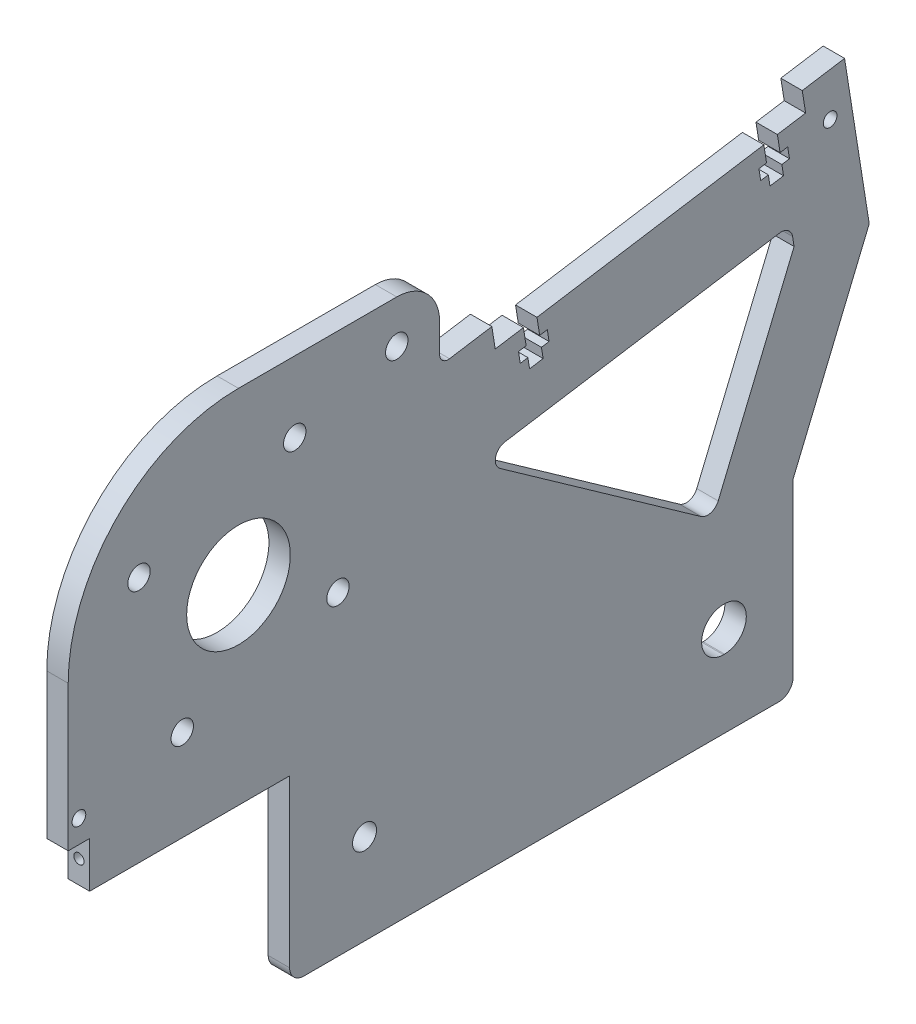
from build123d import *

# Parameters (mm, degrees)
SKETCH1_R           = 2.4892
SKETCH1_R_2         = 2.667
SKETCH1_R_3         = 1.524
SKETCH1_R_4         = 11.522750336
BOSS_EXTRUDE1_DEPTH = 4.7625
SKETCH2_R           = 1.1303
CUT_EXTRUDE1_DEPTH  = 6.35


with BuildPart() as part:
    # Sketch1 → Boss-Extrude1 (new body)
    with BuildSketch(Plane(origin=(0, 0, 0), x_dir=(0, 0, -1), z_dir=(1, 0, 0))):
        with BuildLine():
            Line((-28.170295117, 0), (77.382795117, 0))
            ThreePointArc((77.382795117, 0), (79.627859148, 0.92993597), (80.557795117, 3.175))
            Line((80.557795117, 3.175), (80.557795117, 41.307035595))
            Line((80.557795117, 41.307035595), (97.47645297, 81.978005717))
            Line((97.47645297, 81.978005717), (92.000706017, 116.550511334))
            Line((92.000706017, 116.550511334), (82.592974573, 115.060473054))
            Line((82.592974573, 115.060473054), (83.337993713, 110.356607332))
            Line((83.337993713, 110.356607332), (77.06617275, 109.363248479))
            Line((77.06617275, 109.363248479), (77.667154856, 105.568796797))
            Line((77.667154856, 105.568796797), (79.360546516, 105.837003687))
            Line((79.360546516, 105.837003687), (79.752923263, 103.359634407))
            Line((79.752923263, 103.359634407), (78.059531603, 103.091427516))
            Line((78.059531603, 103.091427516), (78.432041173, 100.739494655))
            Line((78.432041173, 100.739494655), (75.421567111, 100.262682406))
            Line((75.421567111, 100.262682406), (75.049057541, 102.614615267))
            Line((75.049057541, 102.614615267), (73.355665881, 102.346408377))
            Line((73.355665881, 102.346408377), (72.963289134, 104.823777657))
            Line((72.963289134, 104.823777657), (74.656680794, 105.091984547))
            Line((74.656680794, 105.091984547), (74.055698688, 108.88643623))
            Line((74.055698688, 108.88643623), (23.630258147, 100.899831052))
            Line((23.630258147, 100.899831052), (24.231240253, 97.105379369))
            Line((24.231240253, 97.105379369), (25.924631913, 97.373586259))
            Line((25.924631913, 97.373586259), (26.31700866, 94.896216979))
            Line((26.31700866, 94.896216979), (24.623617, 94.628010089))
            Line((24.623617, 94.628010089), (24.99612657, 92.276077228))
            Line((24.99612657, 92.276077228), (21.985652508, 91.799264978))
            Line((21.985652508, 91.799264978), (21.613142938, 94.151197839))
            Line((21.613142938, 94.151197839), (19.919751278, 93.882990949))
            Line((19.919751278, 93.882990949), (19.527374531, 96.360360229))
            Line((19.527374531, 96.360360229), (21.220766191, 96.62856712))
            Line((21.220766191, 96.62856712), (20.619784085, 100.423018802))
            Line((20.619784085, 100.423018802), (14.347963122, 99.429659949))
            Line((14.347963122, 99.429659949), (13.602943983, 104.133525671))
            Line((13.602943983, 104.133525671), (4.195212538, 102.643487392))
            ThreePointArc((4.195212538, 102.643487392), (2.66000635, 103.076460316), (1.992204883, 104.52503368))
            Line((1.992204883, 104.52503368), (1.992204883, 110.875))
            ThreePointArc((1.992204883, 110.875), (-0.797603027, 117.610192091), (-7.532795117, 120.4))
            Line((-7.532795117, 120.4), (-42.707795117, 120.4))
            ThreePointArc((-42.707795117, 120.4), (-69.471786785, 109.313991668), (-80.557795117, 82.55))
            Line((-80.557795117, 82.55), (-80.557795117, 50.292))
            Line((-80.557795117, 50.292), (-75.795295117, 50.292))
            Line((-75.795295117, 50.292), (-75.795295117, 40.132))
            Line((-75.795295117, 40.132), (-31.345295117, 40.132))
            Line((-31.345295117, 40.132), (-31.345295117, 3.175))
            ThreePointArc((-31.345295117, 3.175), (-30.415359148, 0.92993597), (-28.170295117, 0))
        make_face()
        with Locations((-55.209041359, 60.43939525)):
            Circle(SKETCH1_R, mode=Mode.SUBTRACT)
        with Locations((-14.692204883, 20.066)):
            Circle(SKETCH1_R_2, mode=Mode.SUBTRACT)
        with Locations((-20.597190367, 70.048753759)):
            Circle(SKETCH1_R, mode=Mode.SUBTRACT)
        with Locations((-64.818399868, 95.051246241)):
            Circle(SKETCH1_R, mode=Mode.SUBTRACT)
        with Locations((-30.206548876, 104.66060475)):
            Circle(SKETCH1_R, mode=Mode.SUBTRACT)
        with Locations((-78.176545117, 55.372)):
            Circle(SKETCH1_R_3, mode=Mode.SUBTRACT)
        with Locations((-42.707795117, 82.55)):
            Circle(SKETCH1_R_4, mode=Mode.SUBTRACT)
        with Locations((-7.532795117, 110.875)):
            Circle(SKETCH1_R, mode=Mode.SUBTRACT)
        with Locations((88.786878575, 106.39776075)):
            Circle(SKETCH1_R_3, mode=Mode.SUBTRACT)
        with BuildLine():
            Line((65.317795117, 15.2273), (65.063795117, 15.2273))
            ThreePointArc((65.063795117, 15.2273), (60.225095117, 20.066), (65.063795117, 24.9047))
            Line((65.063795117, 24.9047), (65.317795117, 24.9047))
            ThreePointArc((65.317795117, 24.9047), (70.156495117, 20.066), (65.317795117, 15.2273))
        make_face(mode=Mode.SUBTRACT)
        with BuildLine():
            Line((80.44359285, 88.039057206), (80.774519188, 85.949670538))
            Line((80.774519188, 85.949670538), (63.911091021, 45.411467736))
            ThreePointArc((63.911091021, 45.411467736), (62.269082169, 43.94630806), (60.099239023, 44.313277635))
            Line((60.099239023, 44.313277635), (15.436115304, 75.901424384))
            ThreePointArc((15.436115304, 75.901424384), (14.429240829, 78.552387567), (16.505444161, 80.48391073))
            Line((16.505444161, 80.48391073), (77.537520924, 90.15044205))
            ThreePointArc((77.537520924, 90.15044205), (79.427839006, 89.69661683), (80.44359285, 88.039057206))
        make_face(mode=Mode.SUBTRACT)
    extrude(amount=BOSS_EXTRUDE1_DEPTH)

    # Sketch2 → Cut-Extrude1 (cut)
    with BuildSketch(Plane.XY.offset(75.795295117)):
        with Locations((2.38125, 45.212)):
            Circle(SKETCH2_R)
    extrude(amount=-CUT_EXTRUDE1_DEPTH, mode=Mode.SUBTRACT)


solid = part.part
